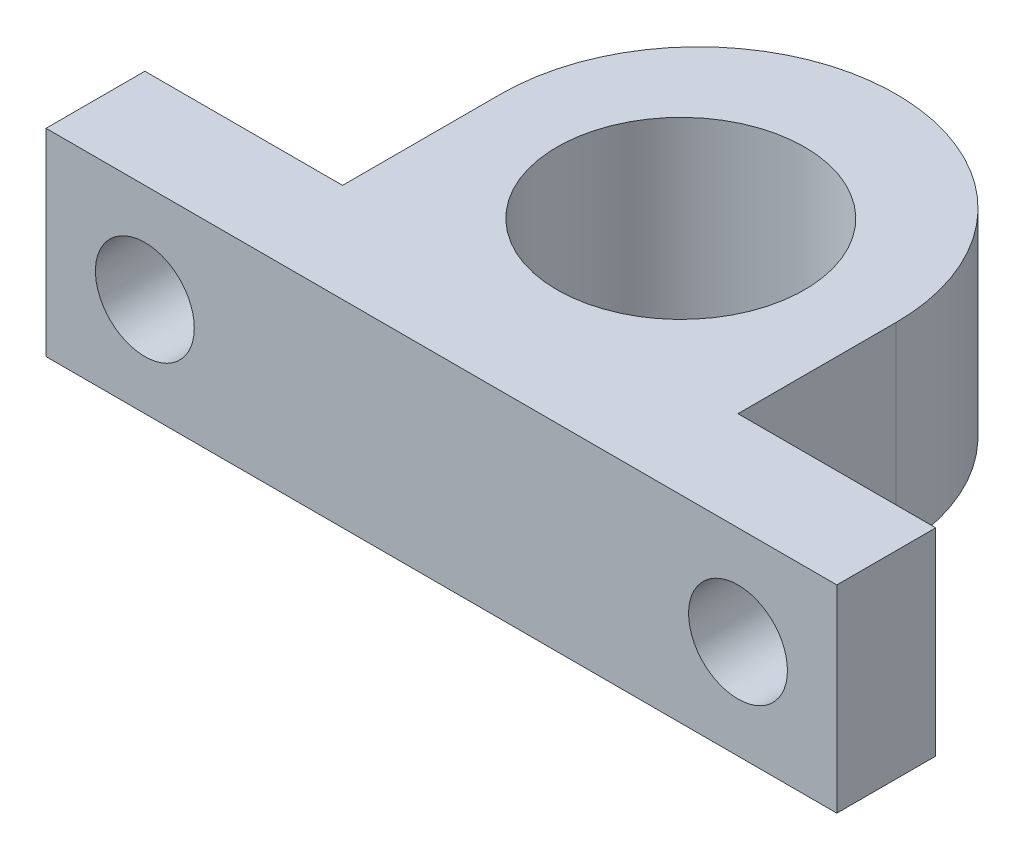
from build123d import *

# Parameters (mm, degrees)
BOSS_EXTRUDE1_DEPTH = 12.7
SKETCH2_R           = 7.9502
CUT_EXTRUDE1_DEPTH  = 41.739097928
SKETCH3_R           = 3.175
CUT_EXTRUDE2_DEPTH  = 41.739097928


with BuildPart() as part:
    # Sketch1 → Boss-Extrude1 (new body)
    with BuildSketch(Plane(origin=(0, 0, 0), x_dir=(1, 0, 0), z_dir=(0, 1, 0))):
        with BuildLine():
            Line((-25.4, 0), (25.4, 0))
            Line((25.4, 0), (25.4, 6.35))
            Line((25.4, 6.35), (12.7, 6.35))
            Line((12.7, 6.35), (12.7, 16.51))
            ThreePointArc((12.7, 16.51), (0, 29.21), (-12.7, 16.51))
            Line((-12.7, 16.51), (-12.7, 6.35))
            Line((-12.7, 6.35), (-25.4, 6.35))
            Line((-25.4, 6.35), (-25.4, 0))
        make_face()
    extrude(amount=BOSS_EXTRUDE1_DEPTH)

    # Sketch2 → Cut-Extrude1 (cut, through all)
    with BuildSketch(Plane(origin=(0, 12.7, 0), x_dir=(1, 0, 0), z_dir=(0, 1, 0))):
        with Locations((0, 15.375414513)):
            Circle(SKETCH2_R)
    extrude(amount=-CUT_EXTRUDE1_DEPTH, mode=Mode.SUBTRACT)

    # Sketch3 → Cut-Extrude2 (cut, through all)
    with BuildSketch(Plane.XY):
        with Locations((-19.05, 6.35)):
            Circle(SKETCH3_R)
        with Locations((19.05, 6.35)):
            Circle(SKETCH3_R)
    extrude(amount=-CUT_EXTRUDE2_DEPTH, mode=Mode.SUBTRACT)


solid = part.part
